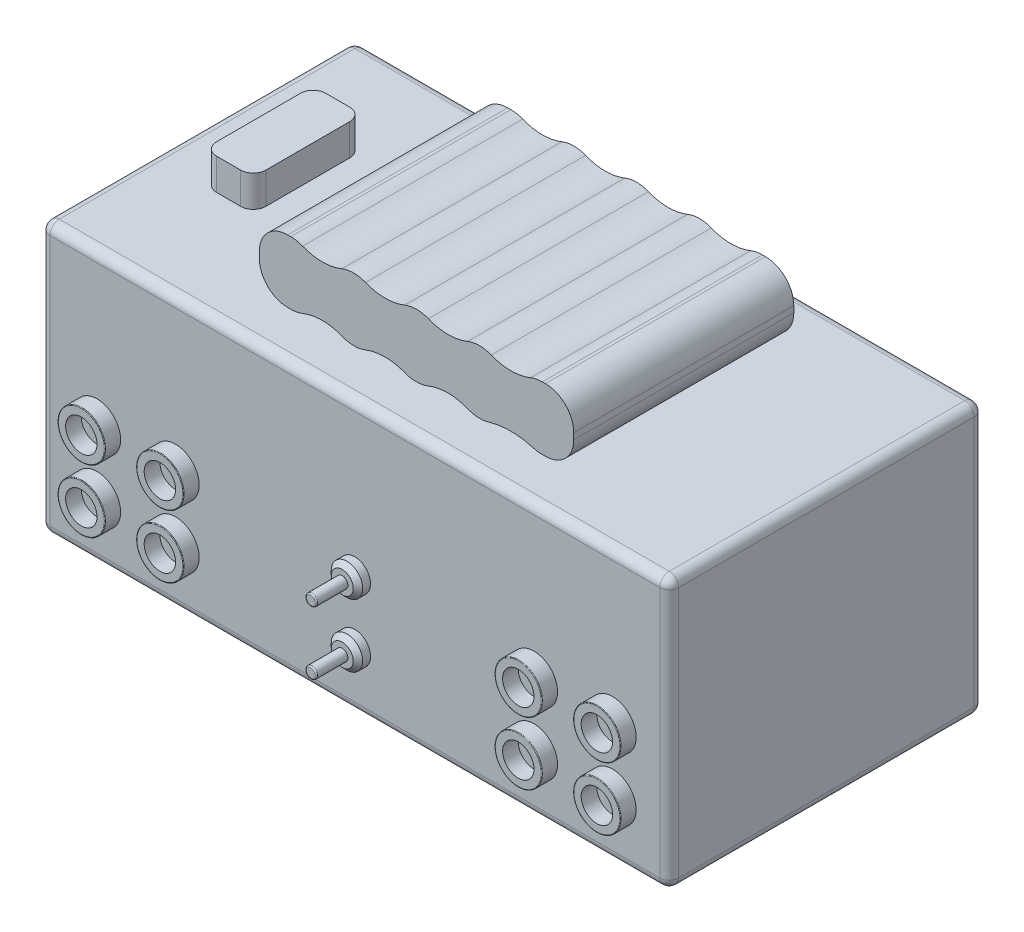
from build123d import *

# Parameters (mm, degrees)
SKETCH2_W           = 127
SKETCH2_H           = 63.5
BOSS_EXTRUDE1_DEPTH = 54.61
FILLET1_R           = 1.905
SKETCH3_R           = 4.7625
SKETCH3_R_2         = 3.175
BOSS_EXTRUDE2_DEPTH = 3.175
FILLET2_R           = 0.127
BOSS_EXTRUDE3_DEPTH = 53.975
CUT_EXTRUDE1_DEPTH  = 9.525
BOSS_EXTRUDE4_DEPTH = 6.35
BOSS_EXTRUDE5_DEPTH = 2.54
SKETCH8_R           = 1.143
BOSS_EXTRUDE6_DEPTH = 6.35
FILLET3_R           = 0.254
CUT_EXTRUDE10_DEPTH = 76.2
CUT_EXTRUDE12_DEPTH = 76.2
CUT_EXTRUDE14_DEPTH = 76.2
CUT_EXTRUDE18_DEPTH = 76.2
CUT_EXTRUDE19_DEPTH = 76.2


with BuildPart() as part:
    # Sketch2 → Boss-Extrude1 (new body)
    with BuildSketch(Plane(origin=(0, 0, 0), x_dir=(1, 0, 0), z_dir=(0, 1, 0))):
        with Locations((63.5, 31.75)):
            Rectangle(SKETCH2_W, SKETCH2_H)
    extrude(amount=BOSS_EXTRUDE1_DEPTH)

    # Fillet1
    fillet1_edges = [part.edges().sort_by_distance(p)[0] for p in [
        (127, 54.61, -31.75),
        (63.5, 54.61, -63.5),
        (0, 54.61, -31.75),
        (63.5, 0, -63.5),
        (127, 0, -31.75),
        (63.5, 0, 0),
        (0, 0, -31.75),
        (63.5, 54.61, 0),
        (0, 27.305, -63.5),
        (127, 27.305, -63.5),
        (127, 27.305, 0),
        (0, 27.305, 0),
    ]]
    fillet(fillet1_edges, radius=FILLET1_R)

    # Sketch3 → Boss-Extrude2 (add)
    # profile 1 of 8: a face of its own
    with BuildSketch(Plane.XY):
        with Locations(Location((11.43, 24.13, 0), (0, 0, 180))):
            Circle(SKETCH3_R)
        with Locations((11.43, 24.13)):
            Circle(SKETCH3_R_2, mode=Mode.SUBTRACT)
    # profile 2 of 8: a face of its own
    with BuildSketch(Plane.XY):
        with Locations(Location((27.305, 24.13, 0), (0, 0, 180))):
            Circle(SKETCH3_R)
        with Locations((27.305, 24.13)):
            Circle(SKETCH3_R_2, mode=Mode.SUBTRACT)
    # profile 3 of 8: a face of its own
    with BuildSketch(Plane.XY):
        with Locations(Location((27.305, 11.43, 0), (0, 0, 180))):
            Circle(SKETCH3_R)
        with Locations((27.305, 11.43)):
            Circle(SKETCH3_R_2, mode=Mode.SUBTRACT)
    # profile 4 of 8: a face of its own
    with BuildSketch(Plane.XY):
        with Locations(Location((11.43, 11.43, 0), (0, 0, 180))):
            Circle(SKETCH3_R)
        with Locations((11.43, 11.43)):
            Circle(SKETCH3_R_2, mode=Mode.SUBTRACT)
    # profile 5 of 8: a face of its own
    with BuildSketch(Plane.XY):
        with Locations((99.695, 11.43)):
            Circle(SKETCH3_R)
        with Locations(Location((99.695, 11.43, 0), (0, 0, 180))):
            Circle(SKETCH3_R_2, mode=Mode.SUBTRACT)
    # profile 6 of 8: a face of its own
    with BuildSketch(Plane.XY):
        with Locations((99.695, 24.13)):
            Circle(SKETCH3_R)
        with Locations(Location((99.695, 24.13, 0), (0, 0, 180))):
            Circle(SKETCH3_R_2, mode=Mode.SUBTRACT)
    # profile 7 of 8: a face of its own
    with BuildSketch(Plane.XY):
        with Locations((115.57, 24.13)):
            Circle(SKETCH3_R)
        with Locations(Location((115.57, 24.13, 0), (0, 0, 180))):
            Circle(SKETCH3_R_2, mode=Mode.SUBTRACT)
    # profile 8 of 8: a face of its own
    with BuildSketch(Plane.XY):
        with Locations((115.57, 11.43)):
            Circle(SKETCH3_R)
        with Locations(Location((115.57, 11.43, 0), (0, 0, 180))):
            Circle(SKETCH3_R_2, mode=Mode.SUBTRACT)
    extrude(amount=BOSS_EXTRUDE2_DEPTH)

    # Fillet2
    fillet2_edges = [part.edges().sort_by_distance(p)[0] for p in [
        (16.1925, 24.13, 3.175),
        (32.0675, 24.13, 3.175),
        (32.0675, 11.43, 3.175),
        (16.1925, 11.43, 3.175),
        (94.9325, 11.43, 3.175),
        (94.9325, 24.13, 3.175),
        (110.8075, 24.13, 3.175),
        (110.8075, 11.43, 3.175),
    ]]
    fillet(fillet2_edges, radius=FILLET2_R)

    # Sketch5 → Boss-Extrude3 (add)
    with BuildSketch(Plane.XY):
        with BuildLine():
            Line((92.482532425, 54.61), (40.412532425, 54.61))
            ThreePointArc((40.412532425, 54.61), (36.371417171, 56.283884746), (34.697532425, 60.325))
            Line((34.697532425, 60.325), (34.697532425, 61.595))
            ThreePointArc((34.697532425, 61.595), (36.371417171, 65.636115254), (40.412532425, 67.31))
            Line((40.412532425, 67.31), (92.482532425, 67.31))
            ThreePointArc((92.482532425, 67.31), (96.52364768, 65.636115254), (98.197532425, 61.595))
            Line((98.197532425, 61.595), (98.197532425, 60.325))
            ThreePointArc((98.197532425, 60.325), (96.52364768, 56.283884746), (92.482532425, 54.61))
        make_face()
    extrude(amount=-BOSS_EXTRUDE3_DEPTH)

    # Sketch5<3> → Cut-Extrude1 (cut)
    with BuildSketch(Plane.XY):
        with BuildLine():
            Line((92.482532425, 54.61), (40.412532425, 54.61))
            ThreePointArc((40.412532425, 54.61), (36.371417171, 56.283884746), (34.697532425, 60.325))
            Line((34.697532425, 60.325), (34.697532425, 61.595))
            ThreePointArc((34.697532425, 61.595), (36.371417171, 65.636115254), (40.412532425, 67.31))
            Line((40.412532425, 67.31), (92.482532425, 67.31))
            ThreePointArc((92.482532425, 67.31), (96.52364768, 65.636115254), (98.197532425, 61.595))
            Line((98.197532425, 61.595), (98.197532425, 60.325))
            ThreePointArc((98.197532425, 60.325), (96.52364768, 56.283884746), (92.482532425, 54.61))
        make_face()
    extrude(amount=-CUT_EXTRUDE1_DEPTH, mode=Mode.SUBTRACT)

    # Sketch6 → Boss-Extrude4 (add)
    with BuildSketch(Plane(origin=(0, 54.61, 0), x_dir=(1, 0, 0), z_dir=(0, 1, 0))):
        with BuildLine():
            Line((13.134221201, 44.48716935), (17.985991951, 44.48716935))
            ThreePointArc((17.985991951, 44.48716935), (19.782043175, 43.743220574), (20.525991951, 41.94716935))
            Line((20.525991951, 41.94716935), (20.525991951, 24.99901115))
            ThreePointArc((20.525991951, 24.99901115), (19.782043175, 23.202959925), (17.985991951, 22.45901115))
            Line((17.985991951, 22.45901115), (13.134221201, 22.45901115))
            ThreePointArc((13.134221201, 22.45901115), (11.338169977, 23.202959925), (10.594221201, 24.99901115))
            Line((10.594221201, 24.99901115), (10.594221201, 41.94716935))
            ThreePointArc((10.594221201, 41.94716935), (11.338169977, 43.743220574), (13.134221201, 44.48716935))
        make_face()
    extrude(amount=BOSS_EXTRUDE4_DEPTH)

    # Sketch7 → Boss-Extrude5 (add)
    with BuildSketch(Plane.XY):
        with BuildLine():
            ThreePointArc((66.675, 24.13), (63.5, 27.305), (60.325, 24.13))
            Line((60.325, 24.13), (66.675, 24.13))
        make_face()
        with BuildLine():
            Line((66.675, 24.13), (60.325, 24.13))
            ThreePointArc((60.325, 24.13), (63.5, 20.955), (66.675, 24.13))
        make_face()
        with BuildLine():
            ThreePointArc((66.675, 11.43), (63.5, 14.605), (60.325, 11.43))
            Line((60.325, 11.43), (66.675, 11.43))
        make_face()
        with BuildLine():
            Line((66.675, 11.43), (60.325, 11.43))
            ThreePointArc((60.325, 11.43), (63.5, 8.255), (66.675, 11.43))
        make_face()
    extrude(amount=BOSS_EXTRUDE5_DEPTH)

    # Chamfer2: read off the stored shape, not the designer's step
    # Chamfer2 outline → Chamfer2 (revolve, cut)
    with BuildSketch(Plane(origin=(63.5, 11.43, 0), x_dir=(1, 0, 0), z_dir=(0, -1, 0))):
        Polygon((3.175, 2.54), (2.2225, 2.54), (3.175, 1.5875), align=None)
    revolve(axis=Axis((63.5, 11.43, 0), (0, 0, 1)), mode=Mode.SUBTRACT)

    # Chamfer2 2 outline → Chamfer2 2 (revolve, cut)
    with BuildSketch(Plane(origin=(63.5, 24.13, 0), x_dir=(1, 0, 0), z_dir=(0, -1, 0))):
        Polygon((3.175, 2.54), (2.2225, 2.54), (3.175, 1.5875), align=None)
    revolve(axis=Axis((63.5, 24.13, 0), (0, 0, 1)), mode=Mode.SUBTRACT)

    # Sketch8 → Boss-Extrude6 (add)
    with BuildSketch(Plane.XY.offset(2.54)):
        with Locations((63.5, 24.13)):
            Circle(SKETCH8_R)
        with Locations((63.5, 11.43)):
            Circle(SKETCH8_R)
    extrude(amount=BOSS_EXTRUDE6_DEPTH)

    # Fillet3
    fillet3_edges = [part.edges().sort_by_distance(p)[0] for p in [
        (62.357, 24.13, 8.89),
        (62.357, 11.43, 8.89),
    ]]
    fillet(fillet3_edges, radius=FILLET3_R)

    # Sketch10 → Cut-Extrude10 (cut)
    with BuildSketch(Plane.XY.offset(-9.525)):
        with BuildLine():
            ThreePointArc((41.047532425, 67.31), (42.262208691, 67.192741096), (43.432024608, 66.845294982))
            ThreePointArc((43.432024608, 66.845294982), (47.397532425, 66.072471572), (51.363040242, 66.845294982))
            ThreePointArc((51.363040242, 66.845294982), (52.532856159, 67.192741096), (53.747532425, 67.31))
            Line((53.747532425, 67.31), (41.047532425, 67.31))
        make_face()
        with BuildLine():
            Line((66.447532425, 67.31), (53.747532425, 67.31))
            ThreePointArc((53.747532425, 67.31), (54.962208691, 67.192741096), (56.132024608, 66.845294982))
            ThreePointArc((56.132024608, 66.845294982), (60.097532425, 66.072471572), (64.063040242, 66.845294982))
            ThreePointArc((64.063040242, 66.845294982), (65.232856159, 67.192741096), (66.447532425, 67.31))
        make_face()
        with BuildLine():
            Line((79.147532425, 67.31), (66.447532425, 67.31))
            ThreePointArc((66.447532425, 67.31), (67.662208691, 67.192741096), (68.832024608, 66.845294982))
            ThreePointArc((68.832024608, 66.845294982), (72.797532425, 66.072471572), (76.763040242, 66.845294982))
            ThreePointArc((76.763040242, 66.845294982), (77.932856159, 67.192741096), (79.147532425, 67.31))
        make_face()
        with BuildLine():
            Line((91.847532425, 67.31), (79.147532425, 67.31))
            ThreePointArc((79.147532425, 67.31), (80.362208691, 67.192741096), (81.532024608, 66.845294982))
            ThreePointArc((81.532024608, 66.845294982), (85.497532425, 66.072471572), (89.463040242, 66.845294982))
            ThreePointArc((89.463040242, 66.845294982), (90.632856159, 67.192741096), (91.847532425, 67.31))
        make_face()
    extrude(amount=-CUT_EXTRUDE10_DEPTH, mode=Mode.SUBTRACT)

    # Sketch10<4> → Cut-Extrude12 (cut)
    with BuildSketch(Plane.XY.offset(-9.525)):
        with BuildLine():
            ThreePointArc((51.363040242, 55.074705018), (47.397532425, 55.847528428), (43.432024608, 55.074705018))
            ThreePointArc((43.432024608, 55.074705018), (42.262208691, 54.727258904), (41.047532425, 54.61))
            Line((41.047532425, 54.61), (53.747532425, 54.61))
            ThreePointArc((53.747532425, 54.61), (52.532856159, 54.727258904), (51.363040242, 55.074705018))
        make_face()
    extrude(amount=-CUT_EXTRUDE12_DEPTH, mode=Mode.SUBTRACT)

    # Sketch10<5> → Cut-Extrude14 (cut)
    with BuildSketch(Plane.XY.offset(-9.525)):
        with BuildLine():
            ThreePointArc((68.832024608, 55.074705018), (67.662208691, 54.727258904), (66.447532425, 54.61))
            Line((66.447532425, 54.61), (79.147532425, 54.61))
            ThreePointArc((79.147532425, 54.61), (77.932856159, 54.727258904), (76.763040242, 55.074705018))
            ThreePointArc((76.763040242, 55.074705018), (72.797532425, 55.847528428), (68.832024608, 55.074705018))
        make_face()
    extrude(amount=-CUT_EXTRUDE14_DEPTH, mode=Mode.SUBTRACT)

    # Sketch10<8> → Cut-Extrude18 (cut)
    with BuildSketch(Plane.XY.offset(-9.525)):
        with BuildLine():
            ThreePointArc((56.077576374, 55.025640696), (55.252398566, 54.756110566), (54.396702002, 54.61))
            Line((54.396702002, 54.61), (65.798362848, 54.61))
            ThreePointArc((65.798362848, 54.61), (64.942666285, 54.756110566), (64.117488476, 55.025640696))
            ThreePointArc((64.117488476, 55.025640696), (62.143200868, 55.59465252), (60.097532425, 55.78655519))
            ThreePointArc((60.097532425, 55.78655519), (58.051863982, 55.59465252), (56.077576374, 55.025640696))
        make_face()
    extrude(amount=-CUT_EXTRUDE18_DEPTH, mode=Mode.SUBTRACT)

    # Sketch10<9> → Cut-Extrude19 (cut)
    with BuildSketch(Plane.XY.offset(-9.525)):
        with BuildLine():
            ThreePointArc((80.970900431, 54.850704822), (80.363595888, 54.70538965), (79.746476677, 54.61))
            Line((79.746476677, 54.61), (91.32278758, 54.61))
            ThreePointArc((91.32278758, 54.61), (90.64469738, 54.703278586), (89.979351354, 54.863970463))
            ThreePointArc((89.979351354, 54.863970463), (87.750167601, 55.350695943), (85.474162117, 55.511819916))
            ThreePointArc((85.474162117, 55.511819916), (83.198641037, 55.343993468), (80.970900431, 54.850704822))
        make_face()
    extrude(amount=-CUT_EXTRUDE19_DEPTH, mode=Mode.SUBTRACT)


solid = part.part
